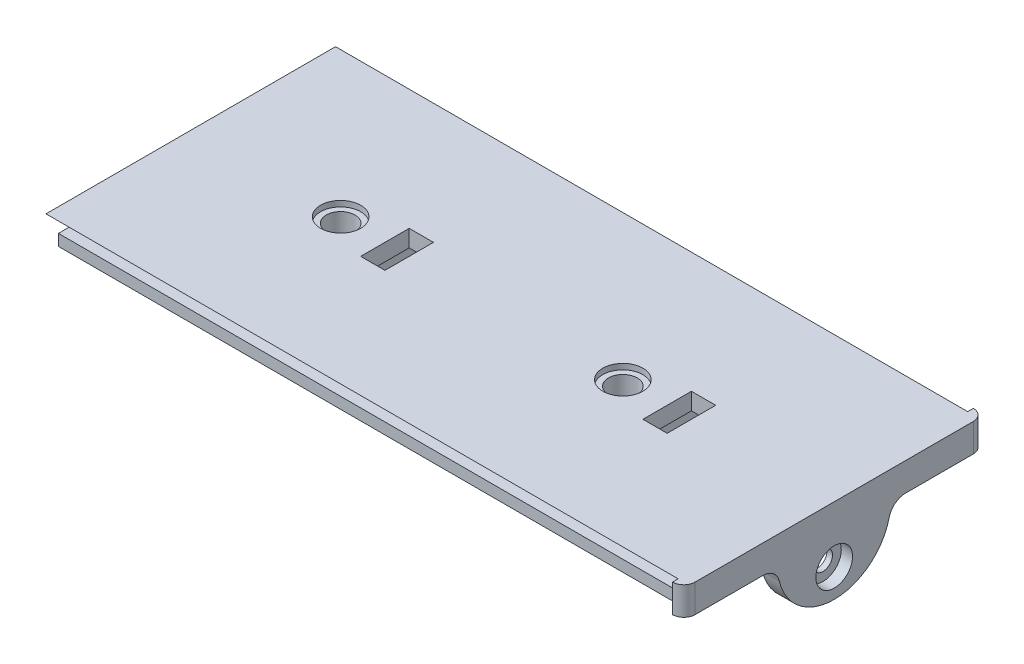
from build123d import *

# Parameters (mm, degrees)
SKETCH1_W                                   = 107.1
SKETCH1_H                                   = 45.3
BOSS_EXTRUDE1_DEPTH                         = 3
SKETCH2_W                                   = 110.9
SKETCH2_H                                   = 49.1
SKETCH2_W_2                                 = 103.1
SKETCH2_H_2                                 = 41.3
BOSS_EXTRUDE2_DEPTH                         = 2
SKETCH5_W                                   = 44.185299266
SKETCH5_H                                   = 3
BOSS_EXTRUDE3_DEPTH                         = 1.9
SKETCH6_W                                   = 53.3
SKETCH6_H                                   = 5
BOSS_EXTRUDE4_DEPTH                         = 2
FILLET1_R                                   = 2
BOSS_EXTRUDE5_DEPTH                         = 3
FILLET2_R                                   = 3
CBORE_FOR_M3_CHEESE_HEAD_SCREW1_D           = 3.4
CBORE_FOR_M3_CHEESE_HEAD_SCREW1_CBORE_D     = 6.5
CBORE_FOR_M3_CHEESE_HEAD_SCREW1_CBORE_DEPTH = 2
SKETCH9_R                                   = 2.55
SKETCH9_W                                   = 4.3
SKETCH9_H                                   = 8.6
CUT_EXTRUDE1_DEPTH                          = 65.457156313
BOSS_EXTRUDE6_START                         = 5
SKETCH11_R                                  = 3.55
SKETCH11_R_2                                = 2.55
SKETCH11_W                                  = 2
SKETCH11_H                                  = 15
BOSS_EXTRUDE6_DEPTH                         = 5
CUT_EXTRUDE2_START                          = -1
SKETCH12_R                                  = 3.55
CUT_EXTRUDE2_DEPTH                          = 1


with BuildPart() as part:
    # Sketch1 → Boss-Extrude1 (new body)
    with BuildSketch(Plane(origin=(0, 0, 0), x_dir=(1, 0, 0), z_dir=(0, 1, 0))):
        Rectangle(SKETCH1_W, SKETCH1_H)
    extrude(amount=BOSS_EXTRUDE1_DEPTH)

    # Sketch2 → Boss-Extrude2 (add)
    with BuildSketch(Plane.XZ):
        Rectangle(SKETCH2_W, SKETCH2_H)
        Rectangle(SKETCH2_W_2, SKETCH2_H_2, mode=Mode.SUBTRACT)
    extrude(amount=BOSS_EXTRUDE2_DEPTH)

    # Sweep3: sweep along a path in Sketch4
    with BuildLine(Plane(origin=(0, 0, 0), x_dir=(1, 0, 0), z_dir=(0, 1, 0))) as sweep3_path:
        Line((55.45, 24.55), (-55.45, 24.55))
        Line((-55.45, 24.55), (-55.45, -24.55))
        Line((-55.45, -24.55), (55.45, -24.55))
    # Sketch3 → Sweep3 (sweep)
    with BuildSketch(Plane(origin=(55.45, 0, 0), x_dir=(0, 0, -1), z_dir=(1, 0, 0))):
        Polygon((-22.65, 3), (-25.65, 3), (-22.65, 0), (-22.092649633, 0), (-22.092649633, 3), align=None)
    sweep(path=sweep3_path.line, transition=Transition.RIGHT)

    # Sketch5 → Boss-Extrude3 (add)
    with BuildSketch(Plane(origin=(53.55, 0, 0), x_dir=(0, 0, -1), z_dir=(1, 0, 0))):
        with Locations((0, 1.5)):
            Rectangle(SKETCH5_W, SKETCH5_H)
    extrude(amount=BOSS_EXTRUDE3_DEPTH)

    # Sketch6 → Boss-Extrude4 (add)
    with BuildSketch(Plane(origin=(55.45, 0, 0), x_dir=(0, 0, -1), z_dir=(1, 0, 0))):
        with Locations((0, 0.5)):
            Rectangle(SKETCH6_W, SKETCH6_H)
    extrude(amount=BOSS_EXTRUDE4_DEPTH)

    # Fillet1
    fillet1_edges = [part.edges().sort_by_distance(p)[0] for p in [
        (57.45, 0.5, 26.65),
        (57.45, 0.5, -26.65),
    ]]
    fillet(fillet1_edges, radius=FILLET1_R - 0.0001)  # a hair under: the kernel refuses the full size

    # Sketch7 → Boss-Extrude5 (add)
    with BuildSketch(Plane(origin=(57.45, 0, 0), x_dir=(0, 0, -1), z_dir=(1, 0, 0))):
        with BuildLine():
            Line((-10, -2), (10, -2))
            ThreePointArc((10, -2), (0, -12), (-10, -2))
        make_face()
    extrude(amount=-BOSS_EXTRUDE5_DEPTH)

    # Fillet2
    fillet2_edges = [part.edges().sort_by_distance(p)[0] for p in [
        (55.95, -2, -10),
        (55.95, -2, 10),
    ]]
    fillet(fillet2_edges, radius=FILLET2_R)

    # CBORE for M3 Cheese Head Screw1 (through all)
    with Locations(Plane(origin=(57.45, -7, 0), x_dir=(0, 0, 1), z_dir=(1, 0, 0))):
        with Locations((0, 0)):
            CounterBoreHole(CBORE_FOR_M3_CHEESE_HEAD_SCREW1_D / 2, CBORE_FOR_M3_CHEESE_HEAD_SCREW1_CBORE_D / 2, CBORE_FOR_M3_CHEESE_HEAD_SCREW1_CBORE_DEPTH)

    # Sketch9 → Cut-Extrude1 (cut, through all)
    with BuildSketch(Plane.XZ):
        with Locations(Location((20, 0, 0), (0, 0, 270))):
            Circle(SKETCH9_R)
        with Locations(Location((-30, 0, 0), (0, 0, 270))):
            Circle(SKETCH9_R)
        with Locations((30, 0)):
            Rectangle(SKETCH9_W, SKETCH9_H)
        with Locations((-20, 0)):
            Rectangle(SKETCH9_W, SKETCH9_H)
    extrude(amount=-CUT_EXTRUDE1_DEPTH, mode=Mode.SUBTRACT)

    # Sketch11 → Boss-Extrude6 (add)
    # profile 1 of 6: a face of its own
    with BuildSketch(Plane.XZ.offset(BOSS_EXTRUDE6_START)):
        with Locations(Location((-30, 0, 0), (0, 0, 90))):
            Circle(SKETCH11_R)
        with Locations(Location((-30, 0, 0), (0, 0, 270))):
            Circle(SKETCH11_R_2, mode=Mode.SUBTRACT)
    # profile 2 of 6: a face of its own
    with BuildSketch(Plane.XZ.offset(BOSS_EXTRUDE6_START)):
        with Locations(Location((20, 0, 0), (0, 0, 90))):
            Circle(SKETCH11_R)
        with Locations(Location((20, 0, 0), (0, 0, 270))):
            Circle(SKETCH11_R_2, mode=Mode.SUBTRACT)
    # profile 3 of 6: a face of its own
    with BuildSketch(Plane.XZ.offset(BOSS_EXTRUDE6_START)):
        with Locations((-15.25, 0)):
            Rectangle(SKETCH11_W, SKETCH11_H)
    # profile 4 of 6: a face of its own
    with BuildSketch(Plane.XZ.offset(BOSS_EXTRUDE6_START)):
        with Locations((-24.75, 0)):
            Rectangle(SKETCH11_W, SKETCH11_H)
    # profile 5 of 6: a face of its own
    with BuildSketch(Plane.XZ.offset(BOSS_EXTRUDE6_START)):
        with Locations((34.516532033, 0)):
            Rectangle(SKETCH11_W, SKETCH11_H)
    # profile 6 of 6: a face of its own
    with BuildSketch(Plane.XZ.offset(BOSS_EXTRUDE6_START)):
        with Locations((25.483467967, 0)):
            Rectangle(SKETCH11_W, SKETCH11_H)
    extrude(amount=-BOSS_EXTRUDE6_DEPTH)

    # Sketch12 → Cut-Extrude2 (cut)
    with BuildSketch(Plane(origin=(0, 3, 0), x_dir=(1, 0, 0), z_dir=(0, 1, 0)).offset(CUT_EXTRUDE2_START)):
        with Locations(Location((-30, 0, 0), (0, 0, 270))):
            Circle(SKETCH12_R)
        with Locations(Location((20, 0, 0), (0, 0, 270))):
            Circle(SKETCH12_R)
    extrude(amount=CUT_EXTRUDE2_DEPTH, mode=Mode.SUBTRACT)


solid = part.part
